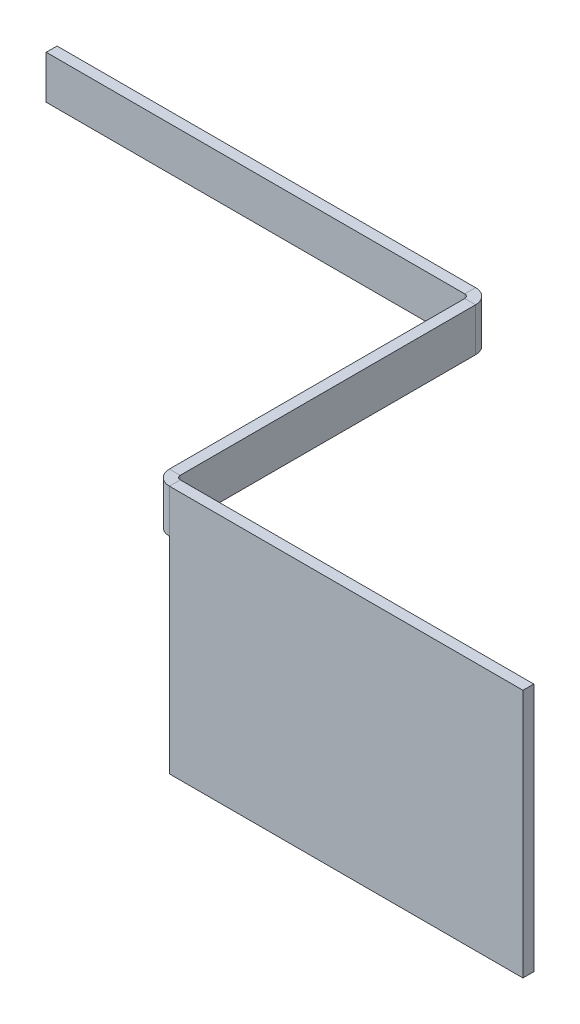
from build123d import *

# Parameters (mm, degrees)
CROQUIS1_W                       = 68
CROQUIS1_H                       = 46
BRIDA_BASE1_DEPTH                = 2
BRIDA_DE_ARISTA1_STRIP_W         = 9.4732
BRIDA_DE_ARISTA1_STRIP_H         = 2
BRIDA_DE_ARISTA1_STRIP_CUT_DEPTH = 46
BRIDA_DE_ARISTA1_DEPTH           = 46
BRIDA_DE_ARISTA2_STRIP_W         = 9.4732
BRIDA_DE_ARISTA2_STRIP_H         = 2
BRIDA_DE_ARISTA2_STRIP_CUT_DEPTH = 46
BRIDA_DE_ARISTA2_DEPTH           = 46
DESDOBLAR1_START                 = -131.122521377
DESDOBLAR1_DEPTH                 = 46
DESDOBLAR1_2_DEPTH               = 46
CROQUIS12_W                      = 137.245889802
CROQUIS12_H                      = 38
CORTAR_EXTRUIR1_DEPTH            = 2
DOBLAR1_START                    = -93.122521377
DOBLAR1_DEPTH                    = 8
DOBLAR1_2_DEPTH                  = 8


# Read off the part's stored shape, not the designer's step: Desdoblar1, Doblar1
# Sheet-metal steps are written as plain solids
with BuildPart() as part:
    # Croquis1 → Brida base1 (new body)
    with BuildSketch(Plane.XY.offset(452.5)):
        with Locations((-159.50357094, -108.122521377)):
            Rectangle(CROQUIS1_W, CROQUIS1_H)
    extrude(amount=-BRIDA_BASE1_DEPTH)

    # Brida de arista1 strip (across the edge) → Brida de arista1 strip cut (cut)
    with BuildSketch(Plane(origin=(-193.50357094, -131.122521377, 450.5), x_dir=(1, 0, 0), z_dir=(0, 1, 0))):
        with Locations((-2, -1)):
            Rectangle(BRIDA_DE_ARISTA1_STRIP_W, BRIDA_DE_ARISTA1_STRIP_H)
    extrude(amount=BRIDA_DE_ARISTA1_STRIP_CUT_DEPTH, mode=Mode.SUBTRACT)

    # Brida de arista1 section (across the edge) → Brida de arista1 (add)
    with BuildSketch(Plane(origin=(-193.50357094, -131.122521377, 450.5), x_dir=(1, 0, 0), z_dir=(0, 1, 0))):
        with BuildLine():
            Line((0, 0.7366), (0, 58))
            Line((0, 58), (2, 58))
            Line((2, 58), (2, 0.7366))
            ThreePointArc((2, 0.7366), (2.215745145, 0.215745145), (2.7366, 0))
            Line((2.7366, 0), (2.7366, -2))
            ThreePointArc((2.7366, -2), (0.801531583, -1.198468417), (0, 0.7366))
        make_face()
    extrude(amount=BRIDA_DE_ARISTA1_DEPTH)

    # Brida de arista2 strip (across the edge) → Brida de arista2 strip cut (cut)
    with BuildSketch(Plane(origin=(-193.50357094, -85.122521377, 392.5), x_dir=(0, 0, 1), z_dir=(0, -1, 0))):
        with Locations((-2, -1)):
            Rectangle(BRIDA_DE_ARISTA2_STRIP_W, BRIDA_DE_ARISTA2_STRIP_H)
    extrude(amount=BRIDA_DE_ARISTA2_STRIP_CUT_DEPTH, mode=Mode.SUBTRACT)

    # Brida de arista2 section (across the edge) → Brida de arista2 (add)
    with BuildSketch(Plane(origin=(-193.50357094, -85.122521377, 392.5), x_dir=(0, 0, 1), z_dir=(0, -1, 0))):
        with BuildLine():
            Line((0, 0.7366), (0, 78))
            Line((0, 78), (2, 78))
            Line((2, 78), (2, 0.7366))
            ThreePointArc((2, 0.7366), (2.215745145, 0.215745145), (2.7366, 0))
            Line((2.7366, 0), (2.7366, -2))
            ThreePointArc((2.7366, -2), (0.801531583, -1.198468417), (0, 0.7366))
        make_face()
    extrude(amount=BRIDA_DE_ARISTA2_DEPTH)

    # Desdoblar1 outline → Desdoblar1 (cut)
    with BuildSketch(Plane(origin=(0, 0, 0), x_dir=(1, 0, 0), z_dir=(0, 1, 0)).offset(DESDOBLAR1_START)):
        with BuildLine():
            ThreePointArc((-193.50357094, -449.7634), (-193.478203969, -450.135145906), (-193.402573338, -450.5))
            Line((-193.402573338, -450.5), (-190.76697094, -450.5))
            ThreePointArc((-190.76697094, -450.5), (-191.287825795, -450.284254855), (-191.50357094, -449.7634))
            Line((-191.50357094, -449.7634), (-191.50357094, -395.2366))
            ThreePointArc((-191.50357094, -395.2366), (-192.305102522, -393.301531582), (-194.24017094, -392.5))
            Line((-194.24017094, -392.5), (-271.50357094, -392.5))
            Line((-271.50357094, -392.5), (-271.50357094, -394.5))
            Line((-271.50357094, -394.5), (-194.24017094, -394.5))
            ThreePointArc((-194.24017094, -394.5), (-193.719316085, -394.715745145), (-193.50357094, -395.2366))
            Line((-193.50357094, -395.2366), (-193.50357094, -449.7634))
        make_face()
    extrude(amount=DESDOBLAR1_DEPTH, mode=Mode.SUBTRACT)

    # Desdoblar1 2 outline → Desdoblar1 2 (add)
    with BuildSketch(Plane(origin=(0, 0, 0), x_dir=(1, 0, 0), z_dir=(0, 1, 0)).offset(DESDOBLAR1_START)):
        with BuildLine():
            Line((-328.012860742, -452.5), (-190.76697094, -452.5))
            ThreePointArc((-190.76697094, -452.5), (-192.421238149, -451.943395312), (-193.402573338, -450.5))
            Line((-193.402573338, -450.5), (-328.012860742, -450.5))
            Line((-328.012860742, -450.5), (-328.012860742, -452.5))
        make_face()
    extrude(amount=DESDOBLAR1_2_DEPTH)

    # Croquis12 → Cortar-Extruir1 (cut)
    with BuildSketch(Plane.XY.offset(452.5)):
        with Locations((-259.389915841, -112.122521377)):
            Rectangle(CROQUIS12_W, CROQUIS12_H)
    extrude(amount=-CORTAR_EXTRUIR1_DEPTH, mode=Mode.SUBTRACT)

    # Doblar1 outline → Doblar1 (cut)
    with BuildSketch(Plane(origin=(0, 0, 0), x_dir=(1, 0, 0), z_dir=(0, 1, 0)).offset(DOBLAR1_START)):
        with BuildLine():
            ThreePointArc((-190.76697094, -452.5), (-192.421238149, -451.943395312), (-193.402573338, -450.5))
            Line((-193.402573338, -450.5), (-328.012860742, -450.5))
            Line((-328.012860742, -450.5), (-328.012860742, -452.5))
            Line((-328.012860742, -452.5), (-190.76697094, -452.5))
        make_face()
    extrude(amount=DOBLAR1_DEPTH, mode=Mode.SUBTRACT)

    # Doblar1 2 outline → Doblar1 2 (add)
    with BuildSketch(Plane(origin=(0, 0, 0), x_dir=(1, 0, 0), z_dir=(0, 1, 0)).offset(DOBLAR1_START)):
        with BuildLine():
            Line((-193.50357094, -395.2366), (-193.50357094, -449.7634))
            ThreePointArc((-193.50357094, -449.7634), (-193.478203969, -450.135145906), (-193.402573338, -450.5))
            Line((-193.402573338, -450.5), (-190.76697094, -450.5))
            ThreePointArc((-190.76697094, -450.5), (-191.287825795, -450.284254855), (-191.50357094, -449.7634))
            Line((-191.50357094, -449.7634), (-191.50357094, -395.2366))
            ThreePointArc((-191.50357094, -395.2366), (-192.305102522, -393.301531582), (-194.24017094, -392.5))
            Line((-194.24017094, -392.5), (-271.50357094, -392.5))
            Line((-271.50357094, -392.5), (-271.50357094, -394.5))
            Line((-271.50357094, -394.5), (-194.24017094, -394.5))
            ThreePointArc((-194.24017094, -394.5), (-193.719316085, -394.715745145), (-193.50357094, -395.2366))
        make_face()
    extrude(amount=DOBLAR1_2_DEPTH)


solid = part.part
